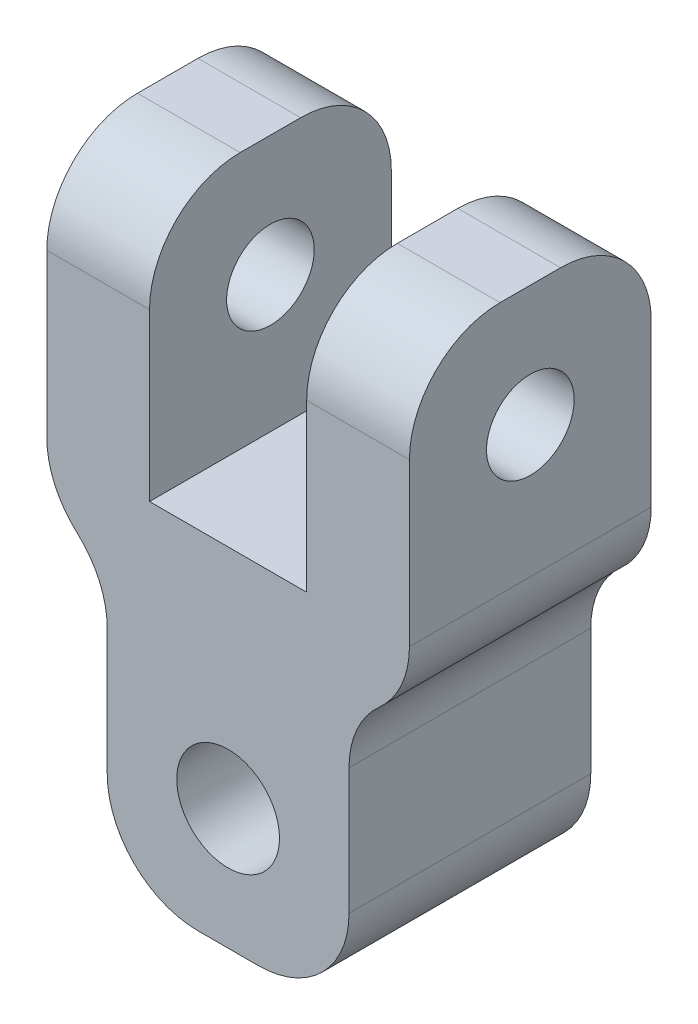
from build123d import *

# Parameters (mm, degrees)
SKETCH_1_W          = 8
SKETCH_1_H          = 8
EXTRUDE_1_DEPTH     = 20
SKETCH_2_R          = 1.7
CUT_EXTRUDE_1_DEPTH = 23.978250586
SKETCH_4_W          = 2
SKETCH_4_H          = 8
EXTRUDE_3_DEPTH     = 10
SKETCH_5_W          = 5.2
SKETCH_5_H          = 8.5
CUT_EXTRUDE_2_DEPTH = 24.748684174
FILLET_1_R          = 3
SKETCH_6_R          = 1.45
CUT_EXTRUDE_3_DEPTH = 25.657656012
FILLET_2_R          = 3


with BuildPart() as part:
    # 草图1 → 凸台-拉伸1 (new body)
    with BuildSketch(Plane(origin=(0, 0, 0), x_dir=(1, 0, 0), z_dir=(0, 1, 0))):
        with Locations((4, -4)):
            Rectangle(SKETCH_1_W, SKETCH_1_H)
    extrude(amount=EXTRUDE_1_DEPTH)

    # 草图2 → 切除-拉伸1 (cut, through all)
    with BuildSketch(Plane.XY.offset(8)):
        with Locations((4, 4)):
            Circle(SKETCH_2_R)
    extrude(amount=-CUT_EXTRUDE_1_DEPTH, mode=Mode.SUBTRACT)

    # 草图4 → 凸台-拉伸3 (add)
    with BuildSketch(Plane(origin=(0, 20, 0), x_dir=(1, 0, 0), z_dir=(0, 1, 0))):
        with Locations((-1, -4)):
            Rectangle(SKETCH_4_W, SKETCH_4_H)
        with Locations((9, -4)):
            Rectangle(SKETCH_4_W, SKETCH_4_H)
    extrude(amount=-EXTRUDE_3_DEPTH)

    # 草图5 → 切除-拉伸2 (cut, through all)
    with BuildSketch(Plane.XY.offset(8)):
        with Locations((4, 15.75)):
            Rectangle(SKETCH_5_W, SKETCH_5_H)
    extrude(amount=-CUT_EXTRUDE_2_DEPTH, mode=Mode.SUBTRACT)

    # 圆角1
    # the kernel refuses this fillet: 3 mm, written as the material it adds along each edge
    with BuildSketch(Plane(origin=(8, 10, 8), x_dir=(0, -1, 0), z_dir=(0, 0, -1))) as fillet_1_piece_1:
        with BuildLine():
            CenterArc((2.828427125, -3), FILLET_1_R, 90, 70.528779366)
            Line((0, -2), (-0.056568542, -1.98))
            ThreePointArc((-0.056568542, -1.98), (-0.06, -1), (-0.06, 0))
            Line((-0.06, 0), (0, 0.06))
            Line((0, 0.06), (2.828427125, 0.06))
            Line((2.828427125, 0.06), (2.828427125, 0))
        make_face()
    extrude(amount=8)
    with BuildSketch(Plane(origin=(0, 10, 8), x_dir=(-1, 0, 0), z_dir=(0, 0, -1))) as fillet_1_piece_2:
        with BuildLine():
            CenterArc((3, -2.828427125), FILLET_1_R, 109.471220634, 70.528779366)
            Line((0, -2.828427125), (-0.06, -2.828427125))
            Line((-0.06, -2.828427125), (-0.06, 0))
            Line((-0.06, 0), (0, 0.06))
            ThreePointArc((0, 0.06), (1, 0.06), (1.98, 0.056568542))
            Line((1.98, 0.056568542), (2, 0))
        make_face()
    extrude(amount=8)

    # 草图6 → 切除-拉伸3 (cut, through all)
    with BuildSketch(Plane(origin=(10, 0, 0), x_dir=(0, 0, -1), z_dir=(1, 0, 0))):
        with Locations((-4, 16)):
            Circle(SKETCH_6_R)
    extrude(amount=-CUT_EXTRUDE_3_DEPTH, mode=Mode.SUBTRACT)

    # 圆角2
    fillet_2_edges = [part.edges().sort_by_distance(p)[0] for p in [
        (8.3, 20, 0),
        (-2, 10, 4),
        (10, 10, 4),
        (-0.3, 20, 0),
        (8.3, 20, 8),
        (8, 0, 4),
        (0, 0, 4),
        (-0.3, 20, 8),
    ]]
    fillet(fillet_2_edges, radius=FILLET_2_R)


solid = part.part
